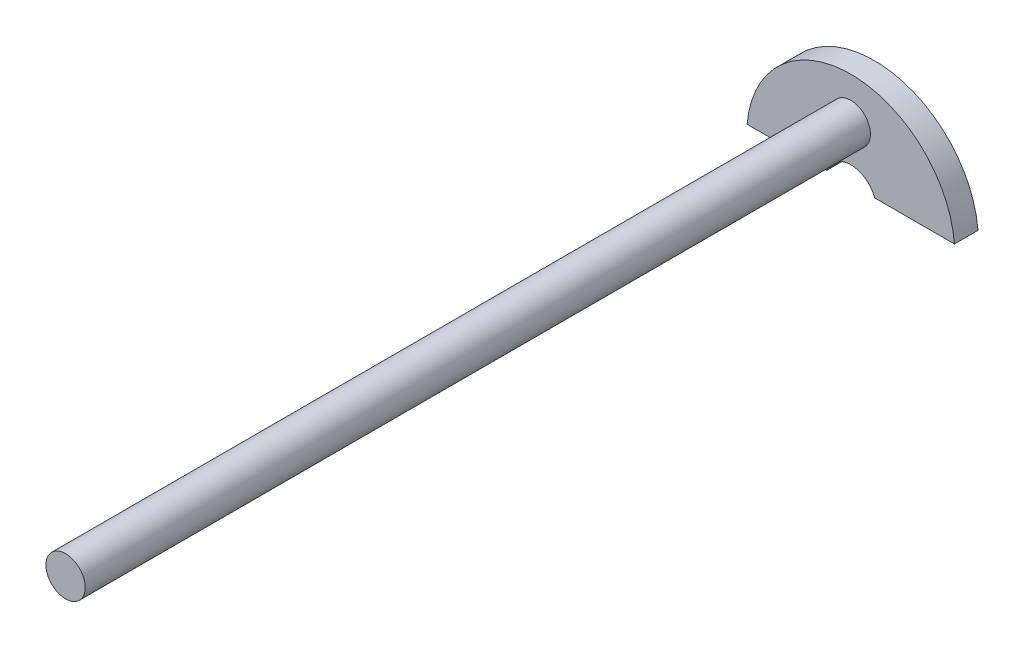
from build123d import *

# Parameters (mm, degrees)
BASEPLATE_DEPTH = 3
SKETCH5_R       = 2.5
ROD_DEPTH       = 100


with BuildPart() as part:
    # Sketch3 → BasePlate (new body)
    with BuildSketch(Plane.XY):
        with BuildLine():
            ThreePointArc((13.20313369, 1.113445447), (0, 13.25), (-13.20313369, 1.113445447))
            Line((-13.20313369, 1.113445447), (-3.053316105, 1.113445447))
            ThreePointArc((-3.053316105, 1.113445447), (0, 3.25), (3.053316105, 1.113445447))
            Line((3.053316105, 1.113445447), (13.20313369, 1.113445447))
        make_face()
    extrude(amount=BASEPLATE_DEPTH)

    # Sketch5 → Rod (add)
    with BuildSketch(Plane.XY.offset(3)):
        with Locations((0, 7.863445447)):
            Circle(SKETCH5_R)
    extrude(amount=ROD_DEPTH)


solid = part.part
